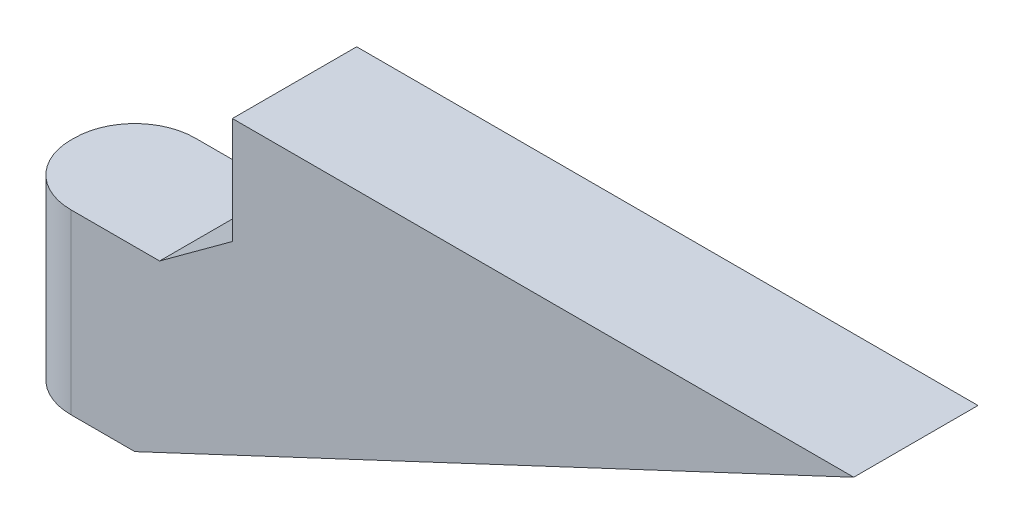
from build123d import *

# Parameters (mm, degrees)
BOSS_EXTRUDE1_DEPTH = 8.89
FILLET1_R           = 4.318


with BuildPart() as part:
    # Sketch1 → Boss-Extrude1 (new body)
    with BuildSketch(Plane.XY):
        Polygon((-19.4945, 0.635), (-30.1625, 0.635), (-30.1625, -12.065), (-21.2725, -12.065), (30.1625, 12.065), (-14.2875, 12.065), (-14.2875, 4.445), align=None)
    extrude(amount=BOSS_EXTRUDE1_DEPTH)

    # Fillet1
    fillet1_edges = [part.edges().sort_by_distance(p)[0] for p in [
        (-30.1625, -5.715, 0),
        (-30.1625, -5.715, 8.89),
    ]]
    fillet(fillet1_edges, radius=FILLET1_R)


solid = part.part
